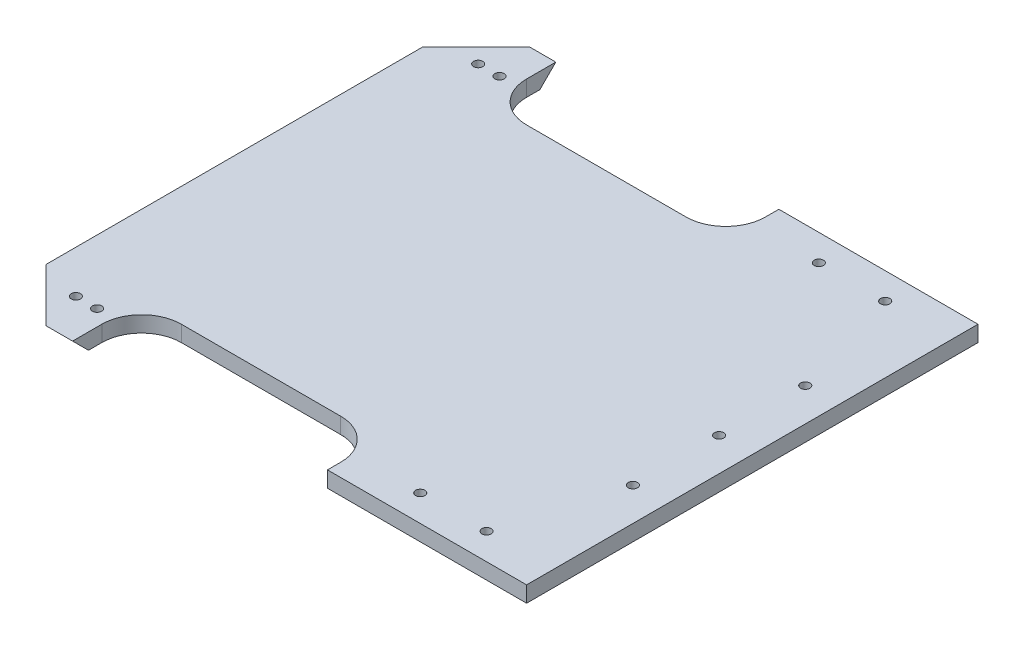
from build123d import *

# Parameters (mm, degrees)
SKETCH1_W           = 195
SKETCH1_H           = 170
BOSS_EXTRUDE1_DEPTH = 6
SKETCH2_W           = 90
SKETCH2_H           = 20
CUT_EXTRUDE1_DEPTH  = 130.48841647
FILLET1_R           = 15
SKETCH3_W           = 30
SKETCH3_H           = 6
BOSS_EXTRUDE2_DEPTH = 6
CHAMFER1_SIZE       = 20
SKETCH4_R           = 1.75
CUT_EXTRUDE2_DEPTH  = 134.503745266
SKETCH7_R           = 1.75
CUT_EXTRUDE5_DEPTH  = 134.503745266
SKETCH8_R           = 1.75
CUT_EXTRUDE6_DEPTH  = 134.503745266
SKETCH6_R           = 3.5
CUT_EXTRUDE4_DEPTH  = 3
CHAMFER3_SIZE       = 6


with BuildPart() as part:
    # Sketch1 → Boss-Extrude1 (new body)
    with BuildSketch(Plane(origin=(0, 0, 0), x_dir=(1, 0, 0), z_dir=(0, 1, 0))):
        Rectangle(SKETCH1_W, SKETCH1_H)
    extrude(amount=BOSS_EXTRUDE1_DEPTH)

    # Sketch2 → Cut-Extrude1 (cut, through all)
    with BuildSketch(Plane(origin=(0, 6, 0), x_dir=(1, 0, 0), z_dir=(0, 1, 0))):
        with Locations((-22.5, -75)):
            Rectangle(SKETCH2_W, SKETCH2_H)
        with Locations((-22.5, 75)):
            Rectangle(SKETCH2_W, SKETCH2_H)
    extrude(amount=-CUT_EXTRUDE1_DEPTH, mode=Mode.SUBTRACT)

    # Fillet1
    fillet1_edges = [part.edges().sort_by_distance(p)[0] for p in [
        (-67.5, 3, 65),
        (22.5, 3, 65),
        (-67.5, 3, -65),
        (22.5, 3, -65),
    ]]
    fillet(fillet1_edges, radius=FILLET1_R)

    # Sketch3 → Boss-Extrude2 (add)
    with BuildSketch(Plane(origin=(0, 6, 0), x_dir=(1, 0, 0), z_dir=(0, 1, 0))):
        with Locations((-82.5, 88)):
            Rectangle(SKETCH3_W, SKETCH3_H)
        with Locations((-82.5, -88)):
            Rectangle(SKETCH3_W, SKETCH3_H)
    extrude(amount=-BOSS_EXTRUDE2_DEPTH)

    # Chamfer1
    chamfer1_edges = [part.edges().sort_by_distance(p)[0] for p in [
        (-97.5, 3, -91),
        (-97.5, 3, 91),
    ]]
    chamfer(chamfer1_edges, length=CHAMFER1_SIZE)

    # Sketch4 → Cut-Extrude2 (cut, through all)
    with BuildSketch(Plane(origin=(0, 6, 0), x_dir=(1, 0, 0), z_dir=(0, 1, 0))):
        with Locations(Location((-81.5, 75.766666667, 0), (0, 0, 270))):
            Circle(SKETCH4_R)
        with Locations(Location((-81.5, -75.766666667, 0), (0, 0, 90))):
            Circle(SKETCH4_R)
        with Locations(Location((-73.5, 75.766666667, 0), (0, 0, 270))):
            Circle(SKETCH4_R)
        with Locations(Location((-73.5, -75.766666667, 0), (0, 0, 90))):
            Circle(SKETCH4_R)
    extrude(amount=-CUT_EXTRUDE2_DEPTH, mode=Mode.SUBTRACT)

    # Sketch7 → Cut-Extrude5 (cut, through all)
    with BuildSketch(Plane.XZ):
        with Locations(Location((47.5, 75.05, 0), (0, 0, 270))):
            Circle(SKETCH7_R)
        with Locations(Location((72.5, 75.05, 0), (0, 0, 270))):
            Circle(SKETCH7_R)
        with Locations(Location((72.5, -75.05, 0), (0, 0, 90))):
            Circle(SKETCH7_R)
        with Locations(Location((47.5, -75.05, 0), (0, 0, 90))):
            Circle(SKETCH7_R)
    extrude(amount=-CUT_EXTRUDE5_DEPTH, mode=Mode.SUBTRACT)

    # Sketch8 → Cut-Extrude6 (cut, through all)
    with BuildSketch(Plane.XZ):
        with Locations(Location((85, 32.45, 0), (0, 0, 270))):
            Circle(SKETCH8_R)
        with Locations(Location((85, 0, 0), (0, 0, 270))):
            Circle(SKETCH8_R)
        with Locations(Location((85, -32.45, 0), (0, 0, 270))):
            Circle(SKETCH8_R)
    extrude(amount=-CUT_EXTRUDE6_DEPTH, mode=Mode.SUBTRACT)

    # Sketch6 → Cut-Extrude4 (cut)
    with BuildSketch(Plane.XZ):
        with Locations(Location((-73.5, 75.766666667, 0), (0, 0, 270))):
            Circle(SKETCH6_R)
        with Locations(Location((-81.5, 75.766666667, 0), (0, 0, 270))):
            Circle(SKETCH6_R)
        with Locations(Location((-73.5, -75.766666667, 0), (0, 0, 90))):
            Circle(SKETCH6_R)
        with Locations(Location((-81.5, -75.766666667, 0), (0, 0, 90))):
            Circle(SKETCH6_R)
        with Locations(Location((47.5, 75.05, 0), (0, 0, 270))):
            Circle(SKETCH6_R)
        with Locations(Location((72.5, 75.05, 0), (0, 0, 270))):
            Circle(SKETCH6_R)
        with Locations(Location((47.5, -75.05, 0), (0, 0, 90))):
            Circle(SKETCH6_R)
        with Locations(Location((72.5, -75.05, 0), (0, 0, 90))):
            Circle(SKETCH6_R)
        with Locations(Location((85, 32.45, 0), (0, 0, 270))):
            Circle(SKETCH6_R)
        with Locations(Location((85, 0, 0), (0, 0, 270))):
            Circle(SKETCH6_R)
        with Locations(Location((85, -32.45, 0), (0, 0, 270))):
            Circle(SKETCH6_R)
    extrude(amount=-CUT_EXTRUDE4_DEPTH, mode=Mode.SUBTRACT)

    # Chamfer3
    chamfer3_edges = [part.edges().sort_by_distance(p)[0] for p in [
        (-72.5, 0, -91),
        (-72.5, 0, 91),
    ]]
    chamfer(chamfer3_edges, length=CHAMFER3_SIZE - 0.0001)  # a hair under: the kernel refuses the full size


solid = part.part
